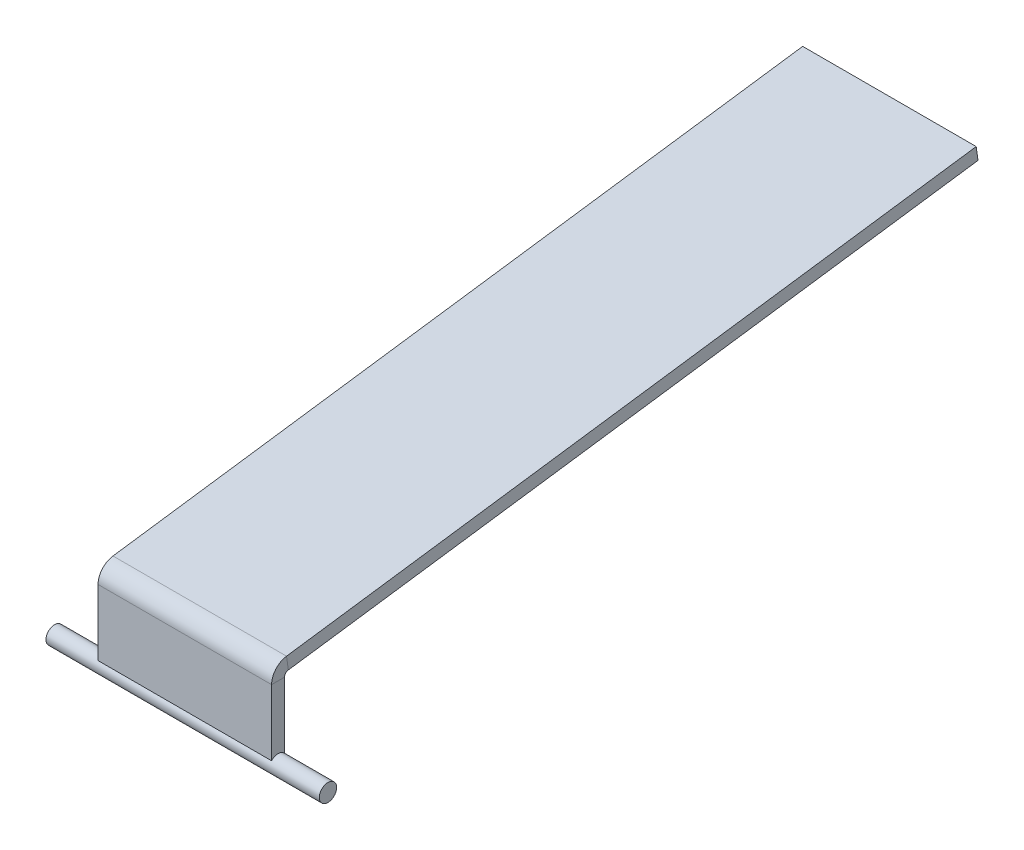
from build123d import *

# Parameters (mm, degrees)
BASE_FLANGE1_DEPTH     = 2
CUT_EXTRUDE1_START     = -2
CUT_EXTRUDE1_OUTLINE_W = 0.3
CUT_EXTRUDE1_OUTLINE_H = 0.067712434
CUT_EXTRUDE1_DEPTH     = 4
SKETCH8_R              = 0.2
BOSS_EXTRUDE1_DEPTH    = 3.15


# Read off the part's stored shape, not the designer's step: Cut-Extrude1
# Sheet-metal steps are written as plain solids
with BuildPart() as part:
    # Sketch1 → Base-Flange1 (new, symmetric)
    with BuildSketch(Plane(origin=(0, 0, 0), x_dir=(0, 0, -1), z_dir=(1, 0, 0))):
        with BuildLine():
            Line((0, 0), (0, 1.852075023))
            ThreePointArc((0, 1.852075023), (0.09819474, 2.114588994), (0.344567924, 2.24821551))
            Line((0.344567924, 2.24821551), (16.24175994, 4.472715125))
            Line((16.24175994, 4.472715125), (16.283333998, 4.17560976))
            Line((16.283333998, 4.17560976), (0.386141981, 1.951110145))
            ThreePointArc((0.386141981, 1.951110145), (0.324548685, 1.917703516), (0.3, 1.852075023))
            Line((0.3, 1.852075023), (0.3, 0))
            Line((0.3, 0), (0, 0))
        make_face()
    extrude(amount=BASE_FLANGE1_DEPTH, both=True)

    # Cut-Extrude1 outline → Cut-Extrude1 (cut)
    with BuildSketch(Plane(origin=(0, 0, 0), x_dir=(0, 0, -1), z_dir=(1, 0, 0)).offset(CUT_EXTRUDE1_START)):
        with Locations((0.15, 0.033856217)):
            Rectangle(CUT_EXTRUDE1_OUTLINE_W, CUT_EXTRUDE1_OUTLINE_H)
    extrude(amount=CUT_EXTRUDE1_DEPTH, mode=Mode.SUBTRACT)

    # Sketch8 → Boss-Extrude1 (add, symmetric)
    with BuildSketch(Plane(origin=(0, 0, 0), x_dir=(0, 0, -1), z_dir=(1, 0, 0))):
        with Locations((0.15, 0.2)):
            Circle(SKETCH8_R)
    extrude(amount=BOSS_EXTRUDE1_DEPTH, both=True)


solid = part.part
